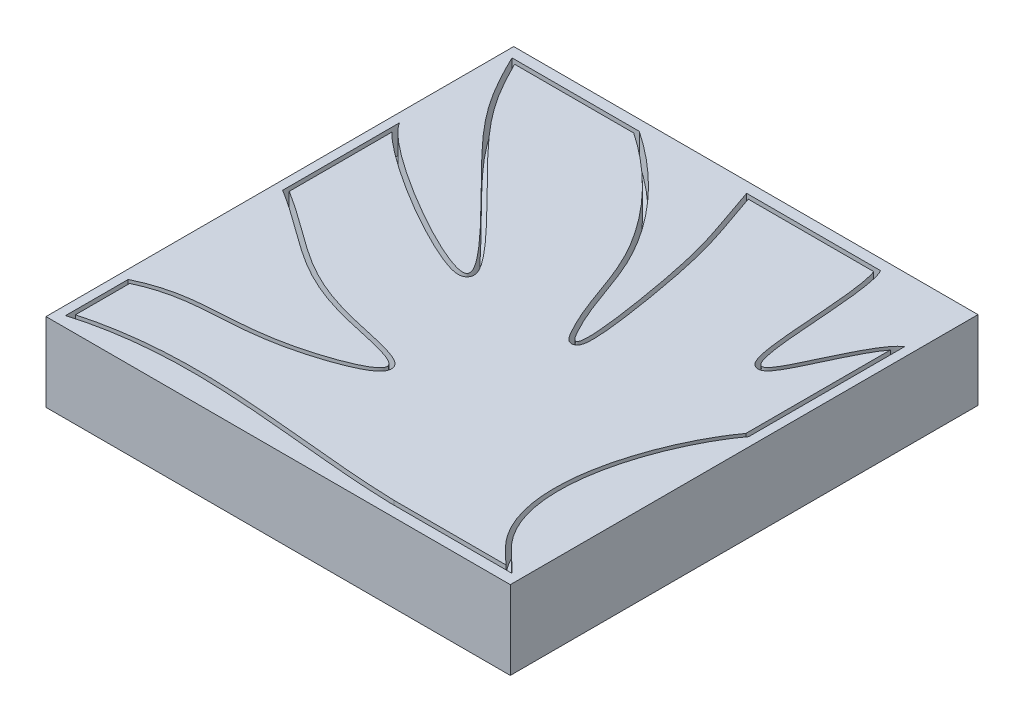
from build123d import *

# Parameters (mm, degrees)
SKETCH_1_R                = 18.7
EXTRUDE_1_DEPTH           = 10
SKETCH_2_W                = 21
SKETCH_2_H                = 21
CUT_EXTRUDE_1_DEPTH       = 3
SKETCH_3_W                = 50
SKETCH_3_H                = 50
SKETCH_3_R                = 20
EXTRUDE_2_DEPTH           = 10
SKETCH_3_2_R              = 20
SKETCH_3_2_R_2            = 18.7
EXTRUDE_3_DEPTH           = 2.75
SKETCH_4_R                = 1
SKETCH_4_W                = 2
SKETCH_4_H                = 13
SKETCH_4_H_2              = 9
EXTRUDE_4_DEPTH           = 3
FILLET_1_R                = 1
CUT_EXTRUDE_START         = -1.1
SKETCH_6_R                = 18.7
CUT_EXTRUDE_2_DEPTH       = 1.1
SKETCH_7_W                = 21
SKETCH_7_H                = 21
CUT_EXTRUDE_3_DEPTH       = 1.9
SKETCH_8_W                = 21
SKETCH_8_H                = 21
EXTRUDE_5_DEPTH           = 1.9
CUT_EXTRUDE_START_2       = -7.25
SKETCH_14_R               = 23
SKETCH_14_R_2             = 18.7
CUT_EXTRUDE_4_DEPTH       = 7.25
CUT_EXTRUDE_5_DEPTH       = 37.041642582
EXTRUDE_6_DEPTH           = 0.7
CUT_EXTRUDE_6_DEPTH       = 0.3
SKETCH_21_R               = 16
CUT_EXTRUDE_7_DEPTH       = 0.2
SKETCH_24_R               = 16
SKETCH_24_R_2             = 15.5
CUT_EXTRUDE_9_DEPTH       = 0.5
CUT_EXTRUDE_10_DEPTH      = 37.410026092
CUT_EXTRUDE_10_DEPTH_BACK = 37.410026092
SKETCH_25_OUTSIDE_W       = 66.282
SKETCH_25_OUTSIDE_H       = 66.282
SKETCH_25_OUTSIDE_W_2     = 21.840329668
SKETCH_25_OUTSIDE_H_2     = 22
SKETCH_26_W               = 22
SKETCH_26_H               = 5
CUT_EXTRUDE_11_DEPTH      = 26.955539068
EXTRUDE_7_DEPTH           = 1.3


with BuildPart() as part:
    # 草图1 → 凸台-拉伸1 (new body)
    with BuildSketch(Plane(origin=(0, 0, 0), x_dir=(1, 0, 0), z_dir=(0, 1, 0))):
        with Locations(Location((0, 0, 0), (0, 0, 270))):
            Circle(SKETCH_1_R)
    extrude(amount=EXTRUDE_1_DEPTH)

    # 草图2 → 切除-拉伸1 (cut)
    with BuildSketch(Plane(origin=(0, 10, 0), x_dir=(1, 0, 0), z_dir=(0, 1, 0))):
        Rectangle(SKETCH_2_W, SKETCH_2_H)
    extrude(amount=-CUT_EXTRUDE_1_DEPTH, mode=Mode.SUBTRACT)



with BuildPart() as body_2:
    # 草图3 → 凸台-拉伸2 (new body)
    with BuildSketch(Plane.XZ):
        Rectangle(SKETCH_3_W, SKETCH_3_H)
        with Locations(Location((0, 0, 0), (0, 0, 270))):
            Circle(SKETCH_3_R, mode=Mode.SUBTRACT)
    extrude(amount=-EXTRUDE_2_DEPTH)


with BuildPart() as part_1:
    add(part.part)

    add(body_2.part)  # 凸台-拉伸3 merges body 2
    # 草图3<2> → 凸台-拉伸3 (add)
    with BuildSketch(Plane.XZ):
        with Locations(Location((0, 0, 0), (0, 0, 270))):
            Circle(SKETCH_3_2_R)
        with Locations(Location((0, 0, 0), (0, 0, 270))):
            Circle(SKETCH_3_2_R_2, mode=Mode.SUBTRACT)
    extrude(amount=-EXTRUDE_3_DEPTH)

    # 草图4 → 凸台-拉伸4 (add)
    with BuildSketch(Plane(origin=(0, 7, 0), x_dir=(1, 0, 0), z_dir=(0, 1, 0))):
        with Locations(Location((6, -9, 0), (0, 0, 90))):
            Circle(SKETCH_4_R)
        with Locations((-6, 4)):
            Rectangle(SKETCH_4_W, SKETCH_4_H)
        with Locations((6, 2)):
            Rectangle(SKETCH_4_W, SKETCH_4_H_2)
        with Locations((0, -2)):
            Rectangle(SKETCH_4_W, SKETCH_4_H_2)
    extrude(amount=EXTRUDE_4_DEPTH)

    # 圆角1
    fillet_1_edges = [part_1.edges().sort_by_distance(p)[0] for p in [
        (7, 8.5, 2.5),
        (5, 8.5, 2.5),
        (7, 8.5, -6.5),
        (5, 8.5, -6.5),
        (1, 8.5, 6.5),
        (-1, 8.5, 6.5),
        (1, 8.5, -2.5),
        (-1, 8.5, -2.5),
        (-5, 8.5, 2.5),
        (-7, 8.5, 2.5),
    ]]
    fillet(fillet_1_edges, radius=FILLET_1_R - 0.0001)  # a hair under: the kernel refuses the full size

    # 草图6 → 切除-拉伸2 (cut)
    with BuildSketch(Plane(origin=(0, 10, 0), x_dir=(1, 0, 0), z_dir=(0, 1, 0)).offset(CUT_EXTRUDE_START)):
        with Locations(Location((0, 0, 0), (0, 0, 90))):
            Circle(SKETCH_6_R)
    extrude(amount=CUT_EXTRUDE_2_DEPTH, mode=Mode.SUBTRACT)

    # 草图7 → 切除-拉伸3 (cut)
    with BuildSketch(Plane(origin=(0, 8.9, 0), x_dir=(1, 0, 0), z_dir=(0, 1, 0))):
        Rectangle(SKETCH_7_W, SKETCH_7_H)
    extrude(amount=-CUT_EXTRUDE_3_DEPTH, mode=Mode.SUBTRACT)

    # 草图8 → 凸台-拉伸5 (add)
    with BuildSketch(Plane(origin=(0, 7, 0), x_dir=(1, 0, 0), z_dir=(0, 1, 0))):
        Rectangle(SKETCH_8_W, SKETCH_8_H)
    extrude(amount=EXTRUDE_5_DEPTH)

    # 草图14 → 切除-拉伸4 (cut)
    with BuildSketch(Plane(origin=(0, 10, 0), x_dir=(1, 0, 0), z_dir=(0, 1, 0)).offset(CUT_EXTRUDE_START_2)):
        with Locations(Location((0, 0, 0), (0, 0, 270))):
            Circle(SKETCH_14_R)
        with Locations(Location((0, 0, 0), (0, 0, 90))):
            Circle(SKETCH_14_R_2, mode=Mode.SUBTRACT)
    extrude(amount=CUT_EXTRUDE_4_DEPTH, mode=Mode.SUBTRACT)

    # 草图8<4> → 切除-拉伸5 (cut, through all)
    with BuildSketch(Plane(origin=(0, 7, 0), x_dir=(1, 0, 0), z_dir=(0, 1, 0))):
        with BuildLine():
            Line((-10.5, -7.554248447), (-10.5, -10.5))
            add(Edge.make_bspline(
                [(-10.5, -10.5), (-5.560222752, -9.040849609), (-0.303931194, -10.353222727), (4.742722291, -10.5)],
                knots=[0, 0, 0, 0, 1, 1, 1, 1], degree=3))
            Line((4.742722291, -10.5), (10.5, -10.5))
            add(Edge.make_bspline(
                [(10.5, -10.5), (10.083582079, -10.060309762), (6.773967074, -7.482052659), (8.830661424, -1.592399698), (10.5, 0.633031789)],
                knots=[0, 0, 0, 0, 0.150772845, 1, 1, 1, 1], degree=3))
            Line((10.5, 0.633031789), (10.5, 7.975613968))
            add(Edge.make_bspline(
                [(6.837026224, 10.5), (7.490024771, 9.330081836), (7.098767845, -0.63827082), (9.58905254, 7.366602183), (10.5, 7.975613968)],
                knots=[0, 0, 0, 0, 0.583088547, 1, 1, 1, 1], degree=3))
            Line((6.837026224, 10.5), (0.536366822, 10.5))
            add(Edge.make_bspline(
                [(-4.511778265, 10.5), (-2.394550274, 9.075781628), (0.606128493, 5.939938925), (1.503469796, 2.102697224), (3.026945606, -0.569040196), (1.871452387, 7.256917373), (1.320255212, 8.138186918), (0.536366822, 10.5)],
                knots=[0, 0, 0, 0, 0.349352045, 0.532247483, 0.547437994, 0.729891794, 1, 1, 1, 1], degree=3))
            Line((-4.511778265, 10.5), (-10.5, 10.5))
            add(Edge.make_bspline(
                [(-10.5, 5.208427594), (-9.745871302, 3.886371216), (1.522840998, -2.624825654), (-7.970966812, 6.31273329), (-9.474215923, 8.381882785), (-10.5, 10.5)],
                knots=[0.047888425, 0.047888425, 0.047888425, 0.047888425, 0.424237166, 0.730171823, 1, 1, 1, 1], degree=3))
            Line((-10.5, 5.208427594), (-10.5, -0.290035685))
            add(Edge.make_bspline(
                [(-10.5, -7.554248447), (-8.203244516, -6.446363202), (-5.931196076, -7.323352711), (0.844391627, -4.808406983), (-6.608698088, -3.753545839), (-8.008829367, -1.815779215), (-10.5, -0.290035685)],
                knots=[0, 0, 0, 0, 0.323773633, 0.482802232, 0.639495497, 1, 1, 1, 1], degree=3))
        make_face()
    extrude(amount=CUT_EXTRUDE_5_DEPTH, mode=Mode.SUBTRACT)

    # 草图17 → 凸台-拉伸6 (add)
    with BuildSketch(Plane(origin=(0, 7, 0), x_dir=(1, 0, 0), z_dir=(0, 1, 0))):
        with BuildLine():
            Line((6.837026224, 10.5), (0.536366822, 10.5))
            add(Edge.make_bspline(
                [(0.536366822, 10.5), (1.320255212, 8.138186918), (1.871452387, 7.256917373), (3.026945606, -0.569040196), (1.503469796, 2.102697224), (0.606128493, 5.939938925), (-2.394550274, 9.075781628), (-4.511778265, 10.5)],
                knots=[0, 0, 0, 0, 0.270108206, 0.452562006, 0.467752517, 0.650647955, 1, 1, 1, 1], degree=3))
            Line((-4.511778265, 10.5), (-10.5, 10.5))
            add(Edge.make_bspline(
                [(-10.5, 10.5), (-9.474215923, 8.381882785), (-7.970966812, 6.31273329), (1.522841007, -2.624825663), (-9.745871334, 3.886371234), (-10.5, 5.208427608)],
                knots=[0.047888424, 0.047888424, 0.047888424, 0.047888424, 0.317716601, 0.623651258, 1, 1, 1, 1], degree=3))
            Line((-10.5, 5.208427608), (-10.5, -0.290035685))
            add(Edge.make_bspline(
                [(-10.5, -0.290035685), (-8.008829367, -1.815779215), (-6.608698088, -3.753545839), (0.844391627, -4.808406983), (-5.931196076, -7.323352711), (-8.203244516, -6.446363202), (-10.5, -7.554248447)],
                knots=[0, 0, 0, 0, 0.360504503, 0.517197768, 0.676226367, 1, 1, 1, 1], degree=3))
            Line((-10.5, -7.554248447), (-10.5, -10.5))
            add(Edge.make_bspline(
                [(-10.5, -10.5), (-5.560222752, -9.040849609), (-0.303931194, -10.353222727), (4.742722291, -10.5)],
                knots=[0, 0, 0, 0, 1, 1, 1, 1], degree=3))
            Line((4.742722291, -10.5), (10.5, -10.5))
            add(Edge.make_bspline(
                [(10.5, -10.5), (10.083582079, -10.060309762), (6.773967074, -7.482052659), (8.830661424, -1.592399698), (10.5, 0.633031789)],
                knots=[0, 0, 0, 0, 0.150772845, 1, 1, 1, 1], degree=3))
            Line((10.5, 0.633031789), (10.5, 7.975613968))
            add(Edge.make_bspline(
                [(10.5, 7.975613968), (9.58905254, 7.366602183), (7.098767845, -0.63827082), (7.490024771, 9.330081836), (6.837026224, 10.5)],
                knots=[0, 0, 0, 0, 0.416911453, 1, 1, 1, 1], degree=3))
        make_face()
    extrude(amount=EXTRUDE_6_DEPTH)

    # 草图18 → 切除-拉伸6 (cut)
    with BuildSketch(Plane(origin=(0, 7.7, 0), x_dir=(1, 0, 0), z_dir=(0, 1, 0))):
        with BuildLine():
            Line((4.742722291, -10.5), (10.5, -10.5))
            add(Edge.make_bspline(
                [(10.5, -10.5), (10.083582079, -10.060309762), (6.773967074, -7.482052659), (8.830661424, -1.592399698), (10.5, 0.633031789)],
                knots=[0, 0, 0, 0, 0.150772845, 1, 1, 1, 1], degree=3))
            Line((10.5, 0.633031789), (10.5, 7.975613968))
            add(Edge.make_bspline(
                [(10.5, 7.975613968), (9.58905254, 7.366602183), (7.098767845, -0.63827082), (7.490024771, 9.330081836), (6.837026224, 10.5)],
                knots=[0, 0, 0, 0, 0.416911453, 1, 1, 1, 1], degree=3))
            Line((6.837026224, 10.5), (0.536366822, 10.5))
            add(Edge.make_bspline(
                [(0.536366822, 10.5), (1.320255212, 8.138186918), (1.871452387, 7.256917373), (3.026945606, -0.569040196), (1.503469796, 2.102697224), (0.606128493, 5.939938925), (-2.394550274, 9.075781628), (-4.511778265, 10.5)],
                knots=[0, 0, 0, 0, 0.270108206, 0.452562006, 0.467752517, 0.650647955, 1, 1, 1, 1], degree=3))
            Line((-4.511778265, 10.5), (-10.5, 10.5))
            add(Edge.make_bspline(
                [(-10.5, 10.5), (-9.474215923, 8.381882785), (-7.970966812, 6.31273329), (1.522841007, -2.624825663), (-9.745871334, 3.886371234), (-10.500000006, 5.208427604)],
                knots=[0, 0, 0, 0, 0.269828177, 0.575762834, 0.952111576, 0.952111576, 0.952111576, 0.952111576], degree=3))
            Line((-10.500000006, 5.208427604), (-10.5, -0.290035685))
            add(Edge.make_bspline(
                [(-10.5, -0.290035685), (-8.008829367, -1.815779215), (-6.608698088, -3.753545839), (0.844391627, -4.808406983), (-5.931196076, -7.323352711), (-8.203244516, -6.446363202), (-10.5, -7.554248447)],
                knots=[0, 0, 0, 0, 0.360504503, 0.517197768, 0.676226367, 1, 1, 1, 1], degree=3))
            Line((-10.5, -7.554248447), (-10.5, -10.5))
            add(Edge.make_bspline(
                [(-10.5, -10.5), (-5.560222752, -9.040849609), (-0.303931194, -10.353222727), (4.742722291, -10.5)],
                knots=[0, 0, 0, 0, 1, 1, 1, 1], degree=3))
        make_face()
    extrude(amount=-CUT_EXTRUDE_6_DEPTH, mode=Mode.SUBTRACT)

    # 草图21 → 切除-拉伸7 (cut)
    with BuildSketch(Plane(origin=(0, 8.9, 0), x_dir=(1, 0, 0), z_dir=(0, 1, 0))):
        with Locations(Location((0, 0, 0), (0, 0, 270))):
            Circle(SKETCH_21_R)
    extrude(amount=-CUT_EXTRUDE_7_DEPTH, mode=Mode.SUBTRACT)

    # 草图24 → 切除-拉伸9 (cut)
    with BuildSketch(Plane(origin=(0, 8.9, 0), x_dir=(1, 0, 0), z_dir=(0, 1, 0))):
        with Locations(Location((0, 0, 0), (0, 0, 270))):
            Circle(SKETCH_24_R)
        with Locations(Location((0, 0, 0), (0, 0, 270))):
            Circle(SKETCH_24_R_2, mode=Mode.SUBTRACT)
    extrude(amount=-CUT_EXTRUDE_9_DEPTH, mode=Mode.SUBTRACT)

    # 草图25 outside → 切除-拉伸10 (cut, two sides: drawn at the far end of the back side and taken through both)
    with BuildSketch(Plane(origin=(0, 8.7, 0), x_dir=(1, 0, 0), z_dir=(0, 1, 0)).offset(-CUT_EXTRUDE_10_DEPTH_BACK)):
        Rectangle(SKETCH_25_OUTSIDE_W, SKETCH_25_OUTSIDE_H)
        Rectangle(SKETCH_25_OUTSIDE_W_2, SKETCH_25_OUTSIDE_H_2, mode=Mode.SUBTRACT)
    extrude(amount=CUT_EXTRUDE_10_DEPTH + CUT_EXTRUDE_10_DEPTH_BACK, mode=Mode.SUBTRACT)

    # 草图26 → 切除-拉伸11 (cut, through all)
    with BuildSketch(Plane(origin=(10.920164834, 0, 0), x_dir=(0, 0, -1), z_dir=(1, 0, 0))):
        with Locations((0, 2.5)):
            Rectangle(SKETCH_26_W, SKETCH_26_H)
    extrude(amount=-CUT_EXTRUDE_11_DEPTH, mode=Mode.SUBTRACT)


with BuildPart() as body_2_2:
    # 草图27 → 凸台-拉伸7 (new body)
    with BuildSketch(Plane(origin=(0, 7.4, 0), x_dir=(1, 0, 0), z_dir=(0, 1, 0))):
        with BuildLine():
            Line((-10.3, -7.680926643), (-10.3, -10.234896511))
            add(Edge.make_bspline(
                [(-10.3, -10.234896511), (-9.08407063, -9.899452601), (-6.560067777, -9.544642623), (-2.779651882, -9.660866298), (1.024438867, -10.052047149), (3.497499552, -10.263588573), (4.745634505, -10.3)],
                knots=[0.017066497, 0.017066497, 0.017066497, 0.017066497, 0.262751659, 0.508436821, 0.754121983, 0.999807145, 0.999807145, 0.999807145, 0.999807145], degree=3))
            Line((4.745634505, -10.3), (10.013551082, -10.3))
            add(Edge.make_bspline(
                [(10.013551082, -10.3), (9.656829246, -9.962933499), (8.909022596, -9.305539019), (8.238052062, -7.97022352), (7.985271208, -6.475036941), (8.0611448, -4.884813389), (8.396925437, -3.28651139), (8.925642302, -1.758417789), (9.469521397, -0.616796524), (9.94238882, 0.186605263), (10.17386837, 0.527920408), (10.3, 0.699208934)],
                knots=[0.040455895, 0.040455895, 0.040455895, 0.040455895, 0.159573502, 0.278691109, 0.397808715, 0.516926322, 0.636043929, 0.755161536, 0.874279143, 0.933837946, 0.993396749, 0.993396749, 0.993396749, 0.993396749], degree=3))
            Line((10.3, 0.699208934), (10.3, 7.493061533))
            add(Edge.make_bspline(
                [(10.3, 7.493061533), (10.234111834, 7.407139614), (10.117557541, 7.237756924), (9.860393421, 6.80791737), (9.543416543, 6.18799676), (9.172055225, 5.394044508), (8.822814744, 4.649146336), (8.559202233, 4.144972308), (8.355885922, 3.847802211), (8.20980591, 3.683607985), (7.968393913, 3.565381148), (7.704991037, 3.684510252), (7.594920245, 3.866528129), (7.478837376, 4.159070879), (7.377521117, 4.655101664), (7.283581716, 5.425819583), (7.208390726, 6.315899022), (7.139290423, 7.264278213), (7.065744635, 8.207443108), (6.976184263, 9.082881167), (6.882007769, 9.694973624), (6.786332868, 10.09037763), (6.741372093, 10.226868328), (6.711155314, 10.3)],
                knots=[0.053955139, 0.053955139, 0.053955139, 0.053955139, 0.0829468, 0.11193846, 0.169921781, 0.227905101, 0.285888422, 0.343871743, 0.372863403, 0.401855063, 0.430846724, 0.459838384, 0.488830044, 0.517821705, 0.575805025, 0.633788346, 0.691771667, 0.749754987, 0.807738308, 0.865721629, 0.923704949, 0.95269661, 0.98168827, 0.98168827, 0.98168827, 0.98168827], degree=3))
            Line((6.711155314, 10.3), (0.814112292, 10.3))
            add(Edge.make_bspline(
                [(0.814112292, 10.3), (0.89302739, 10.065640542), (1.061983718, 9.574226034), (1.340265275, 8.782939678), (1.64357343, 7.903316945), (1.965726009, 6.76856679), (2.23669224, 5.515752296), (2.483807677, 4.154857258), (2.668410143, 3.01747373), (2.814214228, 1.927164175), (2.87566856, 1.174611827), (2.8713726, 0.727515236), (2.83780169, 0.518381127), (2.776027421, 0.362713578), (2.613206611, 0.233849823), (2.40781928, 0.274578931), (2.308309326, 0.362141036), (2.216757596, 0.468500488), (2.094068372, 0.658928519), (1.876944724, 1.055956371), (1.615546642, 1.601814616), (1.347816484, 2.258742116), (1.030764358, 3.119579156), (0.663803948, 4.167320296), (0.1034632, 5.363118238), (-0.864751758, 6.89294764), (-2.4046271, 8.648227154), (-3.819756049, 9.789105769), (-4.57299592, 10.3)],
                knots=[0.010357016, 0.010357016, 0.010357016, 0.010357016, 0.041195569, 0.072034122, 0.133711227, 0.195388333, 0.257065439, 0.287903992, 0.318742545, 0.349581098, 0.380419651, 0.395838927, 0.411258204, 0.418967842, 0.42667748, 0.434387118, 0.442096756, 0.449806395, 0.457516033, 0.472935309, 0.503773862, 0.534612415, 0.565450968, 0.627128074, 0.68880518, 0.750482286, 0.873836497, 0.997190709, 0.997190709, 0.997190709, 0.997190709], degree=3))
            Line((-4.57299592, 10.3), (-10.179367131, 10.3))
            add(Edge.make_bspline(
                [(-10.179367131, 10.3), (-10.080319101, 10.100112928), (-9.871238155, 9.68975596), (-9.483673817, 8.982517262), (-8.799271546, 7.884387621), (-7.894149862, 6.785801141), (-6.538498224, 5.377043278), (-5.332861219, 4.163262851), (-4.150454449, 2.953359242), (-3.329272412, 2.053274494), (-2.859589423, 1.458943788), (-2.659245559, 1.149509451), (-2.564308536, 0.928738355), (-2.526741373, 0.766039027), (-2.56858789, 0.555236925), (-2.758327116, 0.420141958), (-2.933321245, 0.405370753), (-3.179585258, 0.428283114), (-3.703426777, 0.574752813), (-4.744879168, 1.024718163), (-6.278305437, 1.838550381), (-7.609996522, 2.63978025), (-8.59955747, 3.294338499), (-9.27316092, 3.773350809), (-9.865238809, 4.23978919), (-10.153774616, 4.498464995), (-10.300000005, 4.646145812)],
                knots=[0.012573026, 0.012573026, 0.012573026, 0.012573026, 0.040842607, 0.069112189, 0.125651352, 0.238729678, 0.295268842, 0.351808005, 0.408347168, 0.464886331, 0.493155913, 0.521425494, 0.535560285, 0.549695076, 0.563829867, 0.577964658, 0.592099448, 0.606234239, 0.634503821, 0.691042984, 0.747582147, 0.80412131, 0.832390892, 0.860660474, 0.888930055, 0.917199637, 0.917199637, 0.917199637, 0.917199637], degree=3))
            Line((-10.300000005, 4.646145812), (-10.3, -0.178363587))
            add(Edge.make_bspline(
                [(-10.3, -0.178363587), (-10.095451446, -0.305208185), (-9.680566411, -0.573362766), (-8.950281821, -1.078082675), (-8.126220962, -1.684898016), (-7.193690008, -2.348191607), (-6.200413987, -2.940549923), (-5.042560242, -3.457450194), (-3.816394996, -3.813650599), (-2.686051935, -4.061431288), (-1.887107722, -4.245881364), (-1.332845958, -4.408099053), (-0.991643066, -4.56126018), (-0.791518844, -4.692681053), (-0.634654992, -4.918126318), (-0.689013308, -5.209320993), (-0.848144675, -5.388421706), (-1.132344729, -5.609170141), (-1.632630703, -5.866937429), (-2.652451575, -6.262362164), (-4.115190298, -6.667138393), (-6.046700285, -6.950956942), (-7.599183886, -6.970301026), (-8.904103636, -7.183227292), (-9.674814119, -7.414721617), (-10.098820581, -7.587802129), (-10.3, -7.680926643)],
                knots=[0.004598469, 0.004598469, 0.004598469, 0.004598469, 0.035533488, 0.066468506, 0.128338544, 0.190208581, 0.252078618, 0.313948655, 0.375818693, 0.406753711, 0.43768873, 0.468623749, 0.484091258, 0.499558767, 0.515026277, 0.530493786, 0.545961295, 0.561428805, 0.592363823, 0.623298842, 0.685168879, 0.747038916, 0.870778991, 0.932649028, 0.963584047, 0.994519066, 0.994519066, 0.994519066, 0.994519066], degree=3))
        make_face()
    extrude(amount=EXTRUDE_7_DEPTH)


solid = Compound([part_1.part, body_2_2.part])
